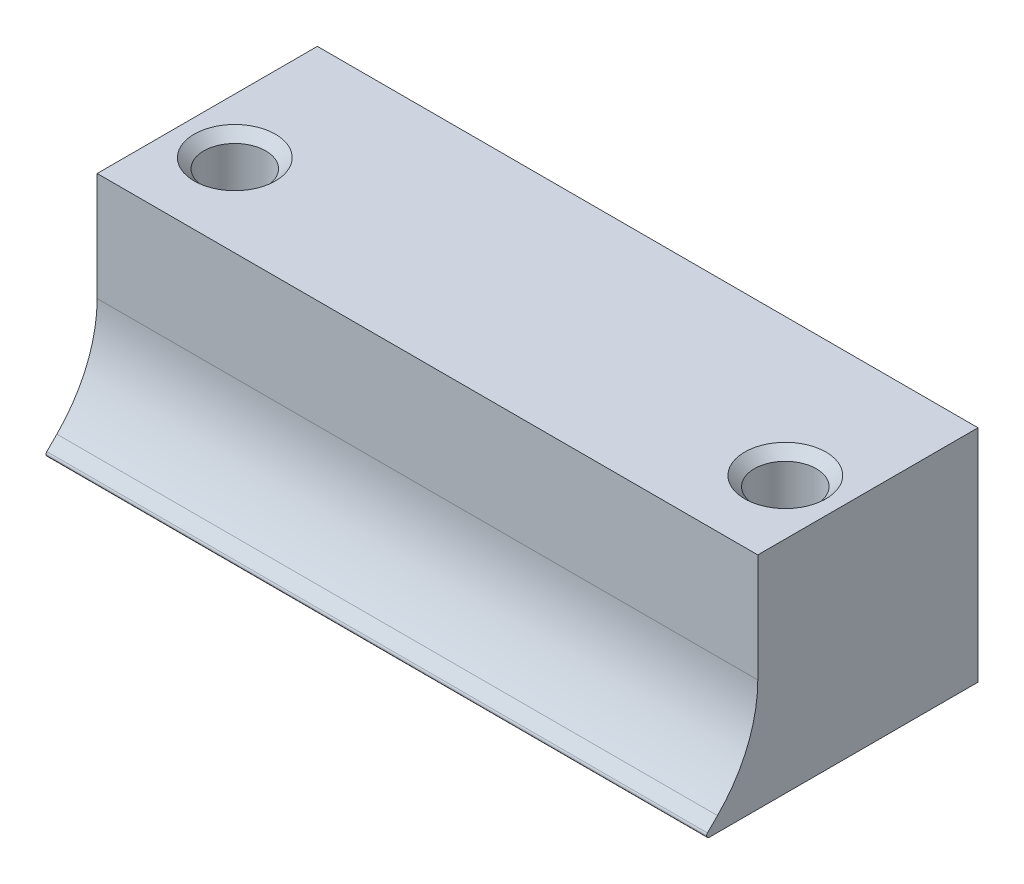
from build123d import *

# Parameters (mm, degrees)
SKETCH1_W                = 20
SKETCH1_H                = 16.01
BOSS_EXTRUDE1_DEPTH      = 48
SKETCH2_R                = 2.25
CUT_EXTRUDE1_DEPTH       = 52.578290976
CHAMFER1_SIZE            = 0.7
CHAMFER1_OF_MIRROR1_SIZE = 0.7
CUT_EXTRUDE2_DEPTH       = 50.679774808
FILLET1_R                = 10
FILLET2_R                = 0.2


with BuildPart() as part:
    # Sketch1 → Boss-Extrude1 (new body)
    with BuildSketch(Plane(origin=(0, 0, 0), x_dir=(0, 0, -1), z_dir=(1, 0, 0))):
        Rectangle(SKETCH1_W, SKETCH1_H)
    extrude(amount=BOSS_EXTRUDE1_DEPTH)

    # Sketch2 → Cut-Extrude1 (cut, through all)
    with BuildSketch(Plane.XZ.offset(8.005)):
        with Locations((4, 0)):
            Circle(SKETCH2_R)
    cut_extrude1 = extrude(amount=-CUT_EXTRUDE1_DEPTH, mode=Mode.SUBTRACT)

    # Chamfer1
    chamfer1_edges = [part.edges().sort_by_distance(p)[0] for p in [
        (1.75, -8.005, 0),
        (1.75, 8.005, 0),
    ]]
    chamfer(chamfer1_edges, length=CHAMFER1_SIZE)

    # Mirror1: Cut-Extrude1 across plane
    add(cut_extrude1.mirror(Plane.ZY.offset(-24)), mode=Mode.SUBTRACT)

    # Chamfer1 of Mirror1
    chamfer1_of_mirror1_edges = [part.edges().sort_by_distance(p)[0] for p in [
        (46.25, -8.005, 0),
        (46.25, 8.005, 0),
    ]]
    chamfer(chamfer1_of_mirror1_edges, length=CHAMFER1_OF_MIRROR1_SIZE)

    # Sketch4 → Cut-Extrude2 (cut, through all)
    with BuildSketch(Plane(origin=(48, 0, 0), x_dir=(0, 0, -1), z_dir=(1, 0, 0))):
        Polygon((-6, 8.005), (-6, -4.005), (-10, -8.005), (-10, 8.005), align=None)
    extrude(amount=-CUT_EXTRUDE2_DEPTH, mode=Mode.SUBTRACT)

    # Fillet1
    fillet1_edges = [part.edges().sort_by_distance(p)[0] for p in [
        (24, -4.005, 6),
    ]]
    fillet(fillet1_edges, radius=FILLET1_R)

    # Fillet2
    fillet2_edges = [part.edges().sort_by_distance(p)[0] for p in [
        (24, -8.005, 10),
    ]]
    fillet(fillet2_edges, radius=FILLET2_R)


solid = part.part
